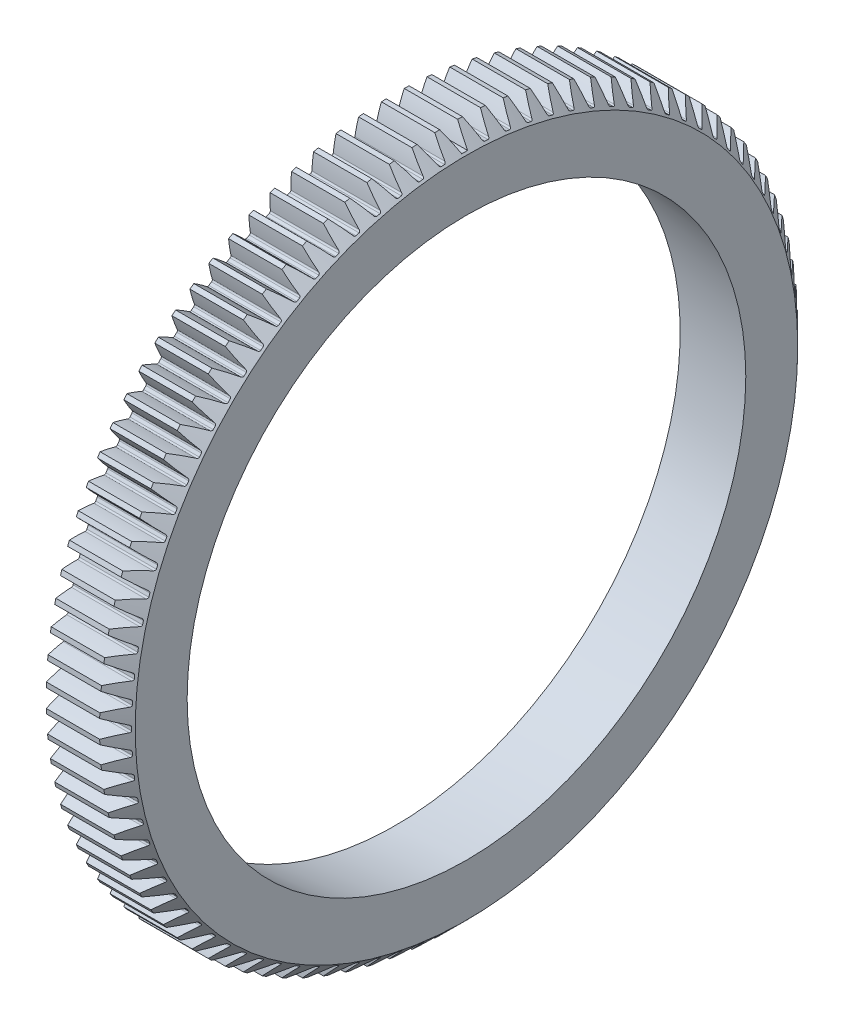
from build123d import *

# Parameters (mm, degrees)
BASPROSKE_W         = 20
BASPROSKE_H         = 98
TOOTHCUT_DEPTH      = 141.028568514
TEETHCUTS_COUNT     = 96
TEETHCUTS_ANGLE     = 356.25
BORSKE_R            = 77.5
BORE_DEPTH          = 50.0000508
FILLET_1_R          = 0.5
SKETCH_1_R          = 80
CUT_EXTRUDE_1_DEPTH = 140.983063313
CUT_EXTRUDE_1_DRAFT = -4.53
SKETCH_2_OUTSIDE_W  = 273.496
SKETCH_2_OUTSIDE_H  = 273.496
SKETCH_2_OUTSIDE_R  = 93
CUT_EXTRUDE_2_DEPTH = 10
CUT_EXTRUDE_2_DRAFT = -45


with BuildPart() as part:
    # BasProSke → Base-Revolve (revolve)
    with BuildSketch(Plane(origin=(0, 0, 0), x_dir=(1, 0, 0), z_dir=(0, 1, 0))):
        with Locations((10, 49)):
            Rectangle(BASPROSKE_W, BASPROSKE_H)
    revolve(axis=Axis((-10, 0, 0), (1, 0, 0)))

    # TooCutSke → ToothCut (cut, through all)
    with BuildSketch(Plane(origin=(0, 0, 0), x_dir=(0, 0, -1), z_dir=(1, 0, 0))):
        with BuildLine():
            ThreePointArc((0.816302804, 93.495436524), (0, 93.499), (-0.816302804, 93.495436524))
            ThreePointArc((-0.816302804, 93.495436524), (-1.605364709, 95.770990559), (-2.535528881, 97.992602468))
            ThreePointArc((-2.535528881, 97.992602468), (0, 98.0254), (2.535528881, 97.992602468))
            ThreePointArc((2.535528881, 97.992602468), (1.605364709, 95.770990559), (0.816302804, 93.495436524))
        make_face()
    toothcut = extrude(amount=TOOTHCUT_DEPTH, mode=Mode.SUBTRACT)

    # TeethCuts: ToothCut ×96 about axis
    teethcuts_axis = Axis((-10, 0, 0), (1, 0, 0))
    for i in range(1, TEETHCUTS_COUNT):
        add(toothcut.rotate(teethcuts_axis, i * TEETHCUTS_ANGLE / (TEETHCUTS_COUNT - 1)), mode=Mode.SUBTRACT)

    # BorSke → Bore (cut, symmetric)
    with BuildSketch(Plane(origin=(0, 0, 0), x_dir=(0, 0, -1), z_dir=(1, 0, 0))):
        Circle(BORSKE_R)
    extrude(amount=BORE_DEPTH, both=True, mode=Mode.SUBTRACT)

    # Скругление1
    fillet_1_edges = [part.edges().sort_by_distance(p)[0] for p in [
        (10, 93.241866859, -6.929449154),
        (10, 93.348644375, -5.300339081),
        (10, 92.589021207, -13.012922539),
        (10, 92.802119, -11.394284099),
        (10, 91.53969515, -19.040672593),
        (10, 91.858200704, -17.439437044),
        (10, 90.098382066, -24.986887563),
        (10, 90.52093149, -23.409911642),
        (10, 88.271253878, -30.826104844),
        (10, 88.796037751, -29.280141405),
        (10, 86.066134629, -36.533320012),
        (10, 86.690905746, -35.024989107),
        (10, 83.492466978, -42.084093895),
        (10, 84.214549974, -40.619854428),
        (10, 80.561271766, -47.454657227),
        (10, 81.377574569, -46.040779297),
        (10, 77.285100819, -52.622012431),
        (10, 78.192127897, -51.26455048),
        (10, 73.677983207, -57.5640321),
        (10, 74.671850529, -56.268798988),
        (10, 69.755365159, -62.259553745),
        (10, 70.831816833, -61.03209586),
        (10, 65.534043928, -66.688470424),
        (10, 66.688470424, -65.534043928),
        (10, 61.03209586, -70.831816833),
        (10, 62.259553745, -69.755365159),
        (10, 56.268798988, -74.671850529),
        (10, 57.5640321, -73.677983207),
        (10, 51.26455048, -78.192127897),
        (10, 52.622012431, -77.285100819),
        (10, 46.040779297, -81.377574569),
        (10, 47.454657227, -80.561271766),
        (10, 40.619854428, -84.214549974),
        (10, 42.084093895, -83.492466978),
        (10, 35.024989107, -86.690905746),
        (10, 36.533320012, -86.066134629),
        (10, 29.280141405, -88.796037751),
        (10, 30.826104844, -88.271253878),
        (10, 23.409911642, -90.52093149),
        (10, 24.986887563, -90.098382066),
        (10, 17.439437044, -91.858200704),
        (10, 19.040672593, -91.53969515),
        (10, 11.394284099, -92.802119),
        (10, 13.012922539, -92.589021207),
        (10, 5.300339081, -93.348644375),
        (10, 6.929449154, -93.241866859),
        (10, -0.816302804, -93.495436524),
        (10, 0.816302804, -93.495436524),
        (10, -6.929449154, -93.241866859),
        (10, -5.300339081, -93.348644375),
        (10, -13.012922539, -92.589021207),
        (10, -11.394284099, -92.802119),
        (10, -19.040672593, -91.53969515),
        (10, -17.439437044, -91.858200704),
        (10, -24.986887563, -90.098382066),
        (10, -23.409911642, -90.52093149),
        (10, -30.826104844, -88.271253878),
        (10, -29.280141405, -88.796037751),
        (10, -36.533320012, -86.066134629),
        (10, -35.024989107, -86.690905746),
        (10, -42.084093895, -83.492466978),
        (10, -40.619854428, -84.214549974),
        (10, -47.454657227, -80.561271766),
        (10, -46.040779297, -81.377574569),
        (10, -52.622012431, -77.285100819),
        (10, -51.26455048, -78.192127897),
        (10, -57.5640321, -73.677983207),
        (10, -56.268798988, -74.671850529),
        (10, -62.259553745, -69.755365159),
        (10, -61.03209586, -70.831816833),
        (10, -66.688470424, -65.534043928),
        (10, -65.534043928, -66.688470424),
        (10, -70.831816833, -61.03209586),
        (10, -69.755365159, -62.259553745),
        (10, -74.671850529, -56.268798988),
        (10, -73.677983207, -57.5640321),
        (10, -78.192127897, -51.26455048),
        (10, -77.285100819, -52.622012431),
        (10, -81.377574569, -46.040779297),
        (10, -80.561271766, -47.454657227),
        (10, -84.214549974, -40.619854428),
        (10, -83.492466978, -42.084093895),
        (10, -86.690905746, -35.024989107),
        (10, -86.066134629, -36.533320012),
        (10, -88.796037751, -29.280141405),
        (10, -88.271253878, -30.826104844),
        (10, -90.52093149, -23.409911642),
        (10, -90.098382066, -24.986887563),
        (10, -91.858200704, -17.439437044),
        (10, -91.53969515, -19.040672593),
        (10, -92.802119, -11.394284099),
        (10, -92.589021207, -13.012922539),
        (10, -93.348644375, -5.300339081),
        (10, -93.241866859, -6.929449154),
        (10, -93.495436524, 0.816302804),
        (10, -93.495436524, -0.816302804),
        (10, -93.241866859, 6.929449154),
        (10, -93.348644375, 5.300339081),
        (10, -92.589021207, 13.012922539),
        (10, -92.802119, 11.394284099),
        (10, -91.53969515, 19.040672593),
        (10, -91.858200704, 17.439437044),
        (10, -90.098382066, 24.986887563),
        (10, -90.52093149, 23.409911642),
        (10, -88.271253878, 30.826104844),
        (10, -88.796037751, 29.280141405),
        (10, -86.066134629, 36.533320012),
        (10, -86.690905746, 35.024989107),
        (10, -83.492466978, 42.084093895),
        (10, -84.214549974, 40.619854428),
        (10, -80.561271766, 47.454657227),
        (10, -81.377574569, 46.040779297),
        (10, -77.285100819, 52.622012431),
        (10, -78.192127897, 51.26455048),
        (10, -73.677983207, 57.5640321),
        (10, -74.671850529, 56.268798988),
        (10, -69.755365159, 62.259553745),
        (10, -70.831816833, 61.03209586),
        (10, -65.534043928, 66.688470424),
        (10, -66.688470424, 65.534043928),
        (10, -61.03209586, 70.831816833),
        (10, -62.259553745, 69.755365159),
        (10, -56.268798988, 74.671850529),
        (10, -57.5640321, 73.677983207),
        (10, -51.26455048, 78.192127897),
        (10, -52.622012431, 77.285100819),
        (10, -46.040779297, 81.377574569),
        (10, -47.454657227, 80.561271766),
        (10, -40.619854428, 84.214549974),
        (10, -42.084093895, 83.492466978),
        (10, -35.024989107, 86.690905746),
        (10, -36.533320012, 86.066134629),
        (10, -29.280141405, 88.796037751),
        (10, -30.826104844, 88.271253878),
        (10, -23.409911642, 90.52093149),
        (10, -24.986887563, 90.098382066),
        (10, -17.439437044, 91.858200704),
        (10, -19.040672593, 91.53969515),
        (10, -11.394284099, 92.802119),
        (10, -13.012922539, 92.589021207),
        (10, -5.300339081, 93.348644375),
        (10, -6.929449154, 93.241866859),
        (10, 0.816302804, 93.495436524),
        (10, 6.929449154, 93.241866859),
        (10, 5.300339081, 93.348644375),
        (10, 13.012922539, 92.589021207),
        (10, 11.394284099, 92.802119),
        (10, 19.040672593, 91.53969515),
        (10, 17.439437044, 91.858200704),
        (10, 24.986887563, 90.098382066),
        (10, 23.409911642, 90.52093149),
        (10, 30.826104844, 88.271253878),
        (10, 29.280141405, 88.796037751),
        (10, 36.533320012, 86.066134629),
        (10, 35.024989107, 86.690905746),
        (10, 42.084093895, 83.492466978),
        (10, 40.619854428, 84.214549974),
        (10, 47.454657227, 80.561271766),
        (10, 46.040779297, 81.377574569),
        (10, 52.622012431, 77.285100819),
        (10, 51.26455048, 78.192127897),
        (10, 57.5640321, 73.677983207),
        (10, 56.268798988, 74.671850529),
        (10, 62.259553745, 69.755365159),
        (10, 61.03209586, 70.831816833),
        (10, 66.688470424, 65.534043928),
        (10, 65.534043928, 66.688470424),
        (10, 70.831816833, 61.03209586),
        (10, 69.755365159, 62.259553745),
        (10, 74.671850529, 56.268798988),
        (10, 73.677983207, 57.5640321),
        (10, 78.192127897, 51.26455048),
        (10, 77.285100819, 52.622012431),
        (10, 81.377574569, 46.040779297),
        (10, 80.561271766, 47.454657227),
        (10, 84.214549974, 40.619854428),
        (10, 83.492466978, 42.084093895),
        (10, 86.690905746, 35.024989107),
        (10, 86.066134629, 36.533320012),
        (10, 88.796037751, 29.280141405),
        (10, 88.271253878, 30.826104844),
        (10, 90.52093149, 23.409911642),
        (10, 90.098382066, 24.986887563),
        (10, 91.858200704, 17.439437044),
        (10, 91.53969515, 19.040672593),
        (10, 92.802119, 11.394284099),
        (10, 92.589021207, 13.012922539),
        (10, 93.348644375, 5.300339081),
        (10, 93.241866859, 6.929449154),
        (10, -0.816302804, 93.495436524),
    ]]
    fillet(fillet_1_edges, radius=FILLET_1_R)


with BuildPart() as cut_extrude_1_tool:
    # Эскиз1 → Вырез-Вытянуть1 (with draft: the straight prism first)
    with BuildSketch(Plane.ZY):
        Circle(SKETCH_1_R)
    extrude(amount=-CUT_EXTRUDE_1_DEPTH)
    # Вырез-Вытянуть1: the draft: its side faces are tilted about the plane it starts from
    cut_extrude_1_sides = [cut_extrude_1_tool.faces().sort_by_distance(p)[0] for p in [
        (70.491531656, 0, -80),
    ]]
    draft(cut_extrude_1_sides, Plane.ZY, CUT_EXTRUDE_1_DRAFT)


with BuildPart() as part_1:
    add(part.part)

    # Вырез-Вытянуть1: cut by cut_extrude_1_tool
    add(cut_extrude_1_tool.part, mode=Mode.SUBTRACT)


with BuildPart() as cut_extrude_2_tool:
    # Эскиз2 outside → Вырез-Вытянуть2 (with draft: the straight prism first)
    with BuildSketch(Plane(origin=(20, 0, 0), x_dir=(0, 0, -1), z_dir=(1, 0, 0))):
        Rectangle(SKETCH_2_OUTSIDE_W, SKETCH_2_OUTSIDE_H)
        Circle(SKETCH_2_OUTSIDE_R, mode=Mode.SUBTRACT)
    extrude(amount=-CUT_EXTRUDE_2_DEPTH)
    # Вырез-Вытянуть2: the draft: its side faces are tilted about the plane it starts from
    cut_extrude_2_sides = [cut_extrude_2_tool.faces().sort_by_distance(p)[0] for p in [
        (15, -136.748, 0),
        (15, 0, -136.748),
        (15, 136.748, 0),
        (15, 0, 136.748),
        (15, 0, 93),
    ]]
    draft(cut_extrude_2_sides, Plane(origin=(20, 0, 0), x_dir=(0, 0, -1), z_dir=(1, 0, 0)), CUT_EXTRUDE_2_DRAFT)


with BuildPart() as part_2:
    add(part_1.part)

    # Вырез-Вытянуть2: cut by cut_extrude_2_tool
    add(cut_extrude_2_tool.part, mode=Mode.SUBTRACT)


solid = part_2.part
